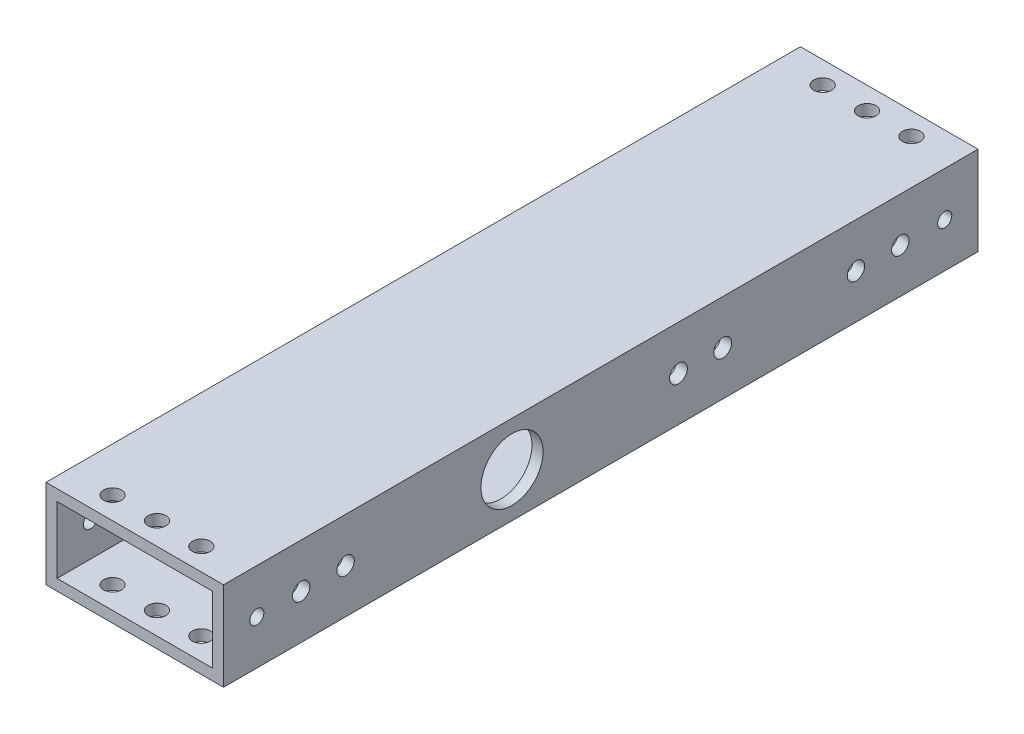
from build123d import *

# Parameters (mm, degrees)
SKETCH1_W           = 50.8
SKETCH1_H           = 25.4
SKETCH1_W_2         = 44.45
SKETCH1_H_2         = 19.05
BOSS_EXTRUDE1_DEPTH = 107.95
SKETCH2_R           = 2.0193
SKETCH2_R_2         = 2.4892
CUT_EXTRUDE1_DEPTH  = 120.979717036
SKETCH3_R           = 2.5527
CUT_EXTRUDE2_DEPTH  = 114.769602707
SKETCH4_R           = 8.89
SKETCH4_R_2         = 2.5527
CUT_EXTRUDE3_DEPTH  = 120.979717036
CUT_EXTRUDE4_REACH  = 115.77
SKETCH5_R           = 2.4892


with BuildPart() as part:
    # Sketch1 → Boss-Extrude1 (new, symmetric)
    with BuildSketch(Plane.XY):
        Rectangle(SKETCH1_W, SKETCH1_H)
        Rectangle(SKETCH1_W_2, SKETCH1_H_2, mode=Mode.SUBTRACT)
    extrude(amount=BOSS_EXTRUDE1_DEPTH, both=True)

    # Sketch2 → Cut-Extrude1 (cut, through all)
    with BuildSketch(Plane(origin=(25.4, 0, 0), x_dir=(0, 0, -1), z_dir=(1, 0, 0))):
        with Locations((-98.425, 0)):
            Circle(SKETCH2_R)
        with Locations((98.425, 0)):
            Circle(SKETCH2_R)
        with Locations((-85.725, 0)):
            Circle(SKETCH2_R_2)
        with Locations((-73.025, 0)):
            Circle(SKETCH2_R_2)
        with Locations((73.025, 0)):
            Circle(SKETCH2_R_2)
        with Locations((85.725, 0)):
            Circle(SKETCH2_R_2)
    extrude(amount=-CUT_EXTRUDE1_DEPTH, mode=Mode.SUBTRACT)

    # Sketch3 → Cut-Extrude2 (cut, through all)
    with BuildSketch(Plane(origin=(0, 12.7, 0), x_dir=(1, 0, 0), z_dir=(0, 1, 0))):
        with Locations((-12.7, -101.6)):
            Circle(SKETCH3_R)
        with Locations((0, -101.6)):
            Circle(SKETCH3_R)
        with Locations((12.7, -101.6)):
            Circle(SKETCH3_R)
        with Locations((12.7, 101.6)):
            Circle(SKETCH3_R)
        with Locations((0, 101.6)):
            Circle(SKETCH3_R)
        with Locations((-12.7, 101.6)):
            Circle(SKETCH3_R)
    extrude(amount=-CUT_EXTRUDE2_DEPTH, mode=Mode.SUBTRACT)

    # Sketch4 → Cut-Extrude3 (cut, through all)
    with BuildSketch(Plane(origin=(25.4, 0, 0), x_dir=(0, 0, -1), z_dir=(1, 0, 0))):
        with Locations((-25.4, 0)):
            Circle(SKETCH4_R)
        with Locations((34.925, 0)):
            Circle(SKETCH4_R_2)
        with Locations((22.225, 0)):
            Circle(SKETCH4_R_2)
    extrude(amount=-CUT_EXTRUDE3_DEPTH, mode=Mode.SUBTRACT)

    # Sketch5 → Cut-Extrude4 (cut, up to next)
    with BuildSketch(Plane.XZ.offset(12.7), mode=Mode.PRIVATE) as cut_extrude4_sk1:
        with Locations((-3.81, 69.85)):
            Circle(SKETCH5_R)
    cut_extrude4_tool1 = extrude(cut_extrude4_sk1.sketch, amount=-CUT_EXTRUDE4_REACH, mode=Mode.PRIVATE) & part.part
    # Sketch5 → Cut-Extrude4 (cut, up to next)
    with BuildSketch(Plane.XZ.offset(12.7), mode=Mode.PRIVATE) as cut_extrude4_sk2:
        with Locations((-16.51, 69.85)):
            Circle(SKETCH5_R)
    cut_extrude4_tool2 = extrude(cut_extrude4_sk2.sketch, amount=-CUT_EXTRUDE4_REACH, mode=Mode.PRIVATE) & part.part
    # Sketch5 → Cut-Extrude4 (cut, up to next)
    with BuildSketch(Plane.XZ.offset(12.7), mode=Mode.PRIVATE) as cut_extrude4_sk3:
        with Locations((-16.51, 57.15)):
            Circle(SKETCH5_R)
    cut_extrude4_tool3 = extrude(cut_extrude4_sk3.sketch, amount=-CUT_EXTRUDE4_REACH, mode=Mode.PRIVATE) & part.part
    # Sketch5 → Cut-Extrude4 (cut, up to next)
    with BuildSketch(Plane.XZ.offset(12.7), mode=Mode.PRIVATE) as cut_extrude4_sk4:
        with Locations((-3.81, 57.15)):
            Circle(SKETCH5_R)
    cut_extrude4_tool4 = extrude(cut_extrude4_sk4.sketch, amount=-CUT_EXTRUDE4_REACH, mode=Mode.PRIVATE) & part.part
    # Sketch5 → Cut-Extrude4 (cut, up to next)
    with BuildSketch(Plane.XZ.offset(12.7), mode=Mode.PRIVATE) as cut_extrude4_sk5:
        with Locations((-3.81, -6.35)):
            Circle(SKETCH5_R)
    cut_extrude4_tool5 = extrude(cut_extrude4_sk5.sketch, amount=-CUT_EXTRUDE4_REACH, mode=Mode.PRIVATE) & part.part
    # Sketch5 → Cut-Extrude4 (cut, up to next)
    with BuildSketch(Plane.XZ.offset(12.7), mode=Mode.PRIVATE) as cut_extrude4_sk6:
        with Locations((-16.51, -6.35)):
            Circle(SKETCH5_R)
    cut_extrude4_tool6 = extrude(cut_extrude4_sk6.sketch, amount=-CUT_EXTRUDE4_REACH, mode=Mode.PRIVATE) & part.part
    # Sketch5 → Cut-Extrude4 (cut, up to next)
    with BuildSketch(Plane.XZ.offset(12.7), mode=Mode.PRIVATE) as cut_extrude4_sk7:
        with Locations((-16.51, -19.05)):
            Circle(SKETCH5_R)
    cut_extrude4_tool7 = extrude(cut_extrude4_sk7.sketch, amount=-CUT_EXTRUDE4_REACH, mode=Mode.PRIVATE) & part.part
    # Sketch5 → Cut-Extrude4 (cut, up to next)
    with BuildSketch(Plane.XZ.offset(12.7), mode=Mode.PRIVATE) as cut_extrude4_sk8:
        with Locations((-3.81, -19.05)):
            Circle(SKETCH5_R)
    cut_extrude4_tool8 = extrude(cut_extrude4_sk8.sketch, amount=-CUT_EXTRUDE4_REACH, mode=Mode.PRIVATE) & part.part
    add(cut_extrude4_tool1.solids().sort_by_distance((-3.81, -12.7, 69.85))[0], mode=Mode.SUBTRACT)
    add(cut_extrude4_tool2.solids().sort_by_distance((-16.51, -12.7, 69.85))[0], mode=Mode.SUBTRACT)
    add(cut_extrude4_tool3.solids().sort_by_distance((-16.51, -12.7, 57.15))[0], mode=Mode.SUBTRACT)
    add(cut_extrude4_tool4.solids().sort_by_distance((-3.81, -12.7, 57.15))[0], mode=Mode.SUBTRACT)
    add(cut_extrude4_tool5.solids().sort_by_distance((-3.81, -12.7, -6.35))[0], mode=Mode.SUBTRACT)
    add(cut_extrude4_tool6.solids().sort_by_distance((-16.51, -12.7, -6.35))[0], mode=Mode.SUBTRACT)
    add(cut_extrude4_tool7.solids().sort_by_distance((-16.51, -12.7, -19.05))[0], mode=Mode.SUBTRACT)
    add(cut_extrude4_tool8.solids().sort_by_distance((-3.81, -12.7, -19.05))[0], mode=Mode.SUBTRACT)


solid = part.part
